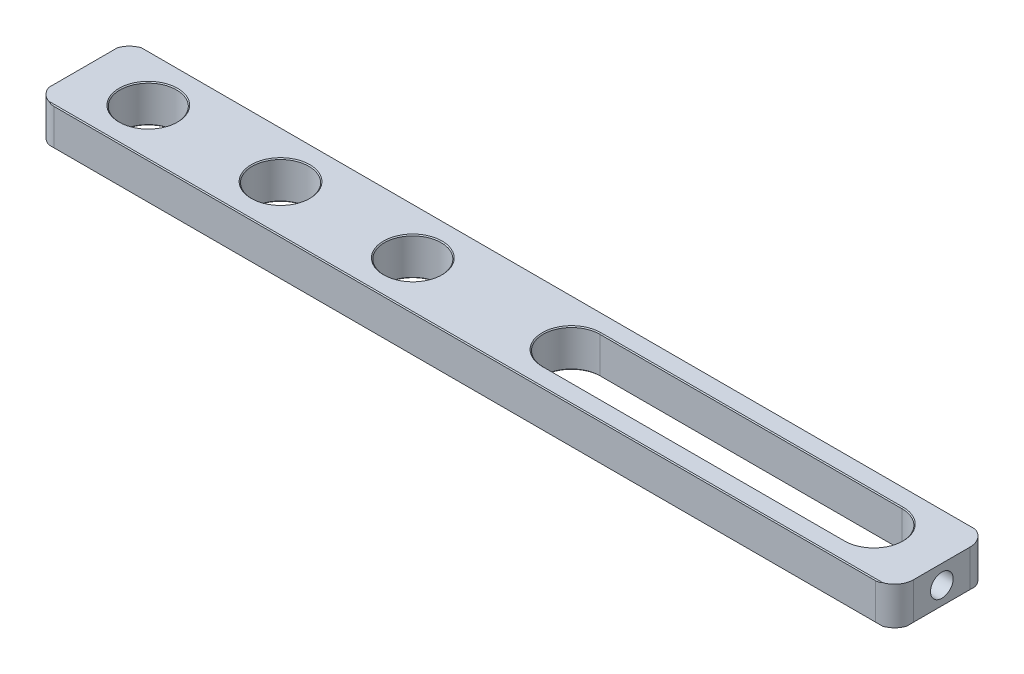
from build123d import *

# Parameters (mm, degrees)
SKETCH_1_W               = 455
SKETCH_1_H               = 50
EXTRUDE_1_DEPTH          = 20
SKETCH_2_R               = 15
CUT_EXTRUDE_1_DEPTH      = 230.741702788
CUT_EXTRUDE_2_REACH      = 458.125
CUT_EXTRUDE_2_END_RADIUS = 15
SKETCH_3_R               = 6
CHAMFER_1_SIZE           = 0.5
CHAMFER_2_SIZE           = 0.5
FILLET_1_R               = 10


with BuildPart() as part:
    # 草图1 → 凸台-拉伸1 (new body)
    with BuildSketch(Plane(origin=(0, 0, 0), x_dir=(1, 0, 0), z_dir=(0, 1, 0))):
        Rectangle(SKETCH_1_W, SKETCH_1_H)
    extrude(amount=EXTRUDE_1_DEPTH)

    # 草图2 → 切除-拉伸1 (cut, through all)
    with BuildSketch(Plane(origin=(0, 20, 0), x_dir=(1, 0, 0), z_dir=(0, 1, 0))):
        with Locations(Location((-192.5, 0, 0), (0, 0, 270))):
            Circle(SKETCH_2_R)
        with Locations(Location((-122.5, 0, 0), (0, 0, 270))):
            Circle(SKETCH_2_R)
        with Locations(Location((-52.5, 0, 0), (0, 0, 270))):
            Circle(SKETCH_2_R)
        with BuildLine():
            Line((31.5, 15), (191.5, 15))
            ThreePointArc((191.5, 15), (206.5, 0), (191.5, -15))
            Line((191.5, -15), (31.5, -15))
            ThreePointArc((31.5, -15), (16.5, 0), (31.5, 15))
        make_face()
    extrude(amount=-CUT_EXTRUDE_1_DEPTH, mode=Mode.SUBTRACT)

    # 切除-拉伸2: up to this cylinder (the profile starts outside it)
    cut_extrude_2_end = Plane(origin=(191.5, 10, 0), z_dir=(0, 1, 0)) * Cylinder(CUT_EXTRUDE_2_END_RADIUS, 947.25, mode=Mode.PRIVATE)
    # 草图3 → 切除-拉伸2 (cut, up to the surface)
    with BuildSketch(Plane(origin=(227.5, 0, 0), x_dir=(0, 0, -1), z_dir=(1, 0, 0)), mode=Mode.PRIVATE) as cut_extrude_2_sk1:
        with Locations((0, 10)):
            Circle(SKETCH_3_R)
    cut_extrude_2_tool1 = extrude(cut_extrude_2_sk1.sketch, amount=-CUT_EXTRUDE_2_REACH, mode=Mode.PRIVATE) - cut_extrude_2_end
    add(cut_extrude_2_tool1.solids().sort_by_distance((227.5, 10, 0))[0], mode=Mode.SUBTRACT)

    # 倒角1
    chamfer_1_edges = [part.edges().sort_by_distance(p)[0] for p in [
        (-192.5, 0, -15),
        (-192.5, 20, -15),
        (-122.5, 0, -15),
        (-122.5, 20, -15),
        (-52.5, 0, -15),
        (-52.5, 20, -15),
        (16.5, 0, 0),
        (111.5, 0, -15),
        (206.5, 0, 0),
        (111.5, 0, 15),
        (16.5, 20, 0),
        (111.5, 20, 15),
        (206.5, 20, 0),
        (111.5, 20, -15),
    ]]
    chamfer(chamfer_1_edges, length=CHAMFER_1_SIZE)

    # 倒角2
    chamfer_2_edges = [part.edges().sort_by_distance(p)[0] for p in [
        (0, 20, -25),
        (-227.5, 20, 0),
        (0, 0, -25),
        (227.5, 0, 0),
        (0, 0, 25),
        (-227.5, 0, 0),
        (0, 20, 25),
    ]]
    chamfer(chamfer_2_edges, length=CHAMFER_2_SIZE)

    # 圆角1
    # the kernel refuses this fillet: 10 mm, written as the material it takes off along each edge
    with BuildSketch(Plane(origin=(227.5, -24.5, 25), x_dir=(0, 0, -1), z_dir=(0, 1, 0)), Plane(origin=(227.5, -24.5, -25), x_dir=(-1, 0, 0), z_dir=(0, 1, 0))) as fillet_1_piece_1:
        with BuildLine():
            CenterArc((FILLET_1_R, FILLET_1_R), FILLET_1_R, 180, 90)
            Line((0, FILLET_1_R), (0, 0))
            Line((0, 0), (FILLET_1_R, 0))
        make_face()
    extrude(amount=69, mode=Mode.SUBTRACT)
    with BuildSketch(Plane(origin=(-227.5, -24.5, -25), x_dir=(1, 0, 0), z_dir=(0, 1, 0)), Plane(origin=(-227.5, -24.5, 25), x_dir=(0, 0, -1), z_dir=(0, 1, 0))) as fillet_1_piece_2:
        with BuildLine():
            CenterArc((FILLET_1_R, -FILLET_1_R), FILLET_1_R, 90, 90)
            Line((0, -FILLET_1_R), (0, 0))
            Line((0, 0), (FILLET_1_R, 0))
        make_face()
    extrude(amount=69, mode=Mode.SUBTRACT)


solid = part.part
